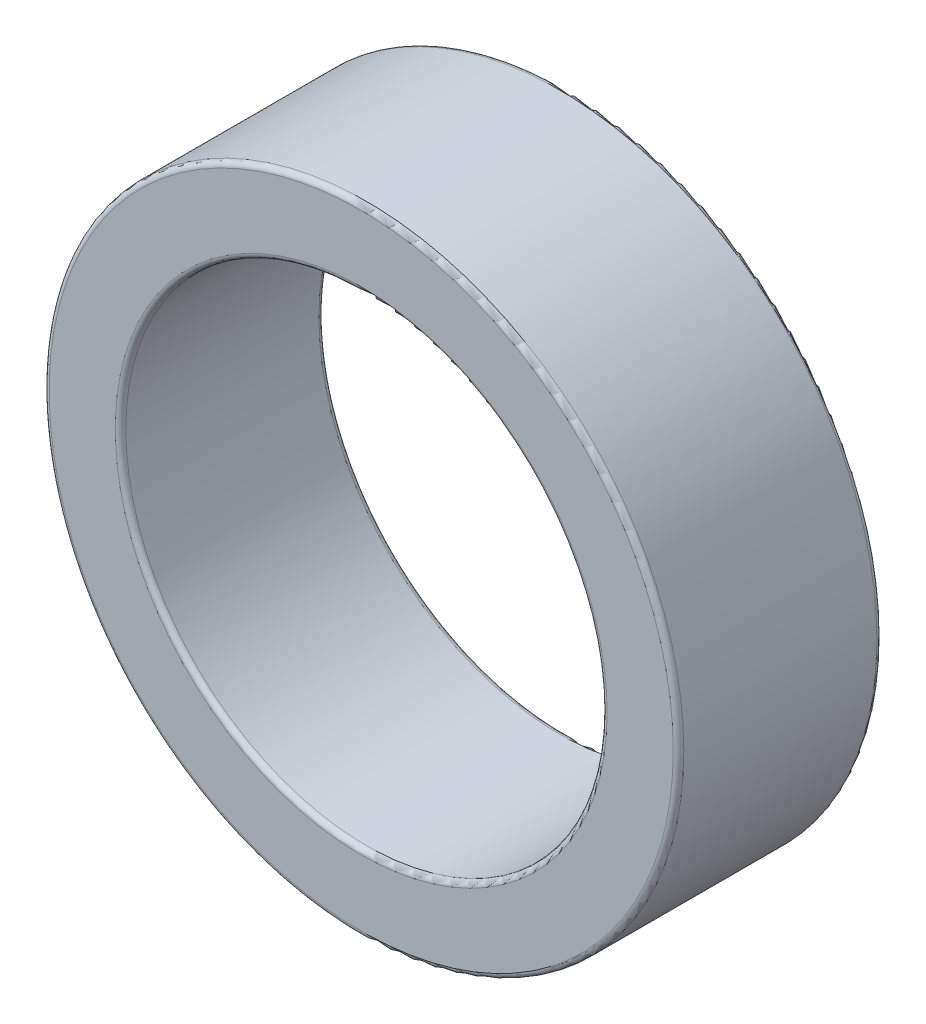
from build123d import *

# Parameters (mm, degrees)
SKETCH1_R           = 6
SKETCH1_R_2         = 4.55
BOSS_EXTRUDE1_DEPTH = 3.85
FILLET1_R           = 0.1


with BuildPart() as part:
    # Sketch1 → Boss-Extrude1 (new body)
    with BuildSketch(Plane.XY):
        Circle(SKETCH1_R)
        Circle(SKETCH1_R_2, mode=Mode.SUBTRACT)
    extrude(amount=BOSS_EXTRUDE1_DEPTH)

    # Fillet1
    fillet1_edges = [part.edges().sort_by_distance(p)[0] for p in [
        (-4.55, 0, 0),
        (-6, 0, 0),
        (-4.55, 0, 3.85),
        (-6, 0, 3.85),
    ]]
    fillet(fillet1_edges, radius=FILLET1_R)


solid = part.part
